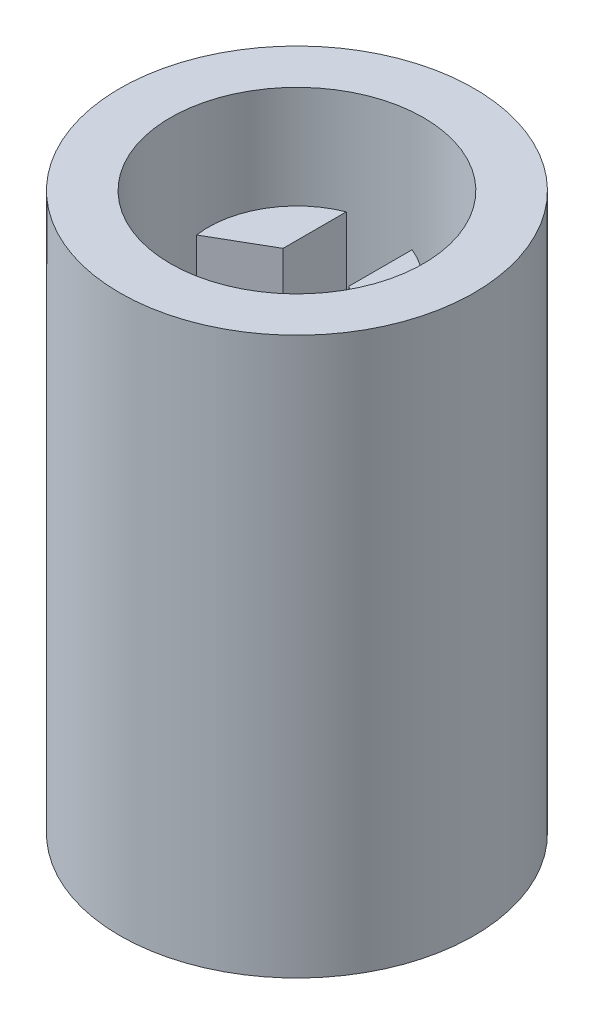
from build123d import *

# Parameters (mm, degrees)
SKETCH1_R           = 7
BOSS_EXTRUDE1_DEPTH = 22
CAVITY1_START       = 2
CAVITY1_OUTLINE_R   = 5
CAVITY1_DEPTH       = 20
CAVITY1_START_2     = 19
CAVITY1_2_DEPTH     = 3
CAVITY1_3_OUTLINE_R = 0.75
CAVITY1_3_DEPTH     = 2
SKETCH2_R           = 0.5
CUT_EXTRUDE1_DEPTH  = 23.315913604


# Read off the part's stored shape, not the designer's step: Cavity1
with BuildPart() as part:
    # Sketch1 → Boss-Extrude1 (new body)
    with BuildSketch(Plane(origin=(0, 0, 0), x_dir=(1, 0, 0), z_dir=(0, 1, 0))):
        with Locations(Location((0, 0, 0), (0, 0, 270))):
            Circle(SKETCH1_R)
    extrude(amount=BOSS_EXTRUDE1_DEPTH)

    # Cavity1 outline → Cavity1 (cut)
    with BuildSketch(Plane(origin=(0, 0, 0), x_dir=(1, 0, 0), z_dir=(0, 1, 0)).offset(CAVITY1_START)):
        Circle(CAVITY1_OUTLINE_R)
        with BuildLine():
            Line((0, -1.5), (2.165063509, -2.75))
            ThreePointArc((2.165063509, -2.75), (0, -3.5), (-2.165063509, -2.75))
            Line((-2.165063509, -2.75), (0, -1.5))
        make_face(mode=Mode.SUBTRACT)
        with BuildLine():
            Line((-1.299038106, 0.75), (-3.464101615, -0.5))
            ThreePointArc((-3.464101615, -0.5), (-3.031088913, 1.75), (-1.299038106, 3.25))
            Line((-1.299038106, 3.25), (-1.299038106, 0.75))
        make_face(mode=Mode.SUBTRACT)
        with BuildLine():
            Line((3.464101615, -0.5), (1.299038106, 0.75))
            Line((1.299038106, 0.75), (1.299038106, 3.25))
            ThreePointArc((1.299038106, 3.25), (3.031088913, 1.75), (3.464101615, -0.5))
        make_face(mode=Mode.SUBTRACT)
    extrude(amount=CAVITY1_DEPTH, mode=Mode.SUBTRACT)

    # Cavity1 2 outline → Cavity1 2 (cut)
    with BuildSketch(Plane(origin=(0, 0, 0), x_dir=(1, 0, 0), z_dir=(0, 1, 0)).offset(CAVITY1_START_2)):
        with BuildLine():
            Line((1.299038106, 3.25), (1.299038106, 0.75))
            Line((1.299038106, 0.75), (3.464101615, -0.5))
            ThreePointArc((3.464101615, -0.5), (3.031088913, 1.75), (1.299038106, 3.25))
        make_face()
        with BuildLine():
            ThreePointArc((-1.299038106, 3.25), (-3.031088913, 1.75), (-3.464101615, -0.5))
            Line((-3.464101615, -0.5), (-1.299038106, 0.75))
            Line((-1.299038106, 0.75), (-1.299038106, 3.25))
        make_face()
        with BuildLine():
            ThreePointArc((-2.165063509, -2.75), (0, -3.5), (2.165063509, -2.75))
            Line((2.165063509, -2.75), (0, -1.5))
            Line((0, -1.5), (-2.165063509, -2.75))
        make_face()
    extrude(amount=CAVITY1_2_DEPTH, mode=Mode.SUBTRACT)

    # Cavity1 3 outline → Cavity1 3 (cut)
    # profile 1 of 3: a face of its own
    with BuildSketch(Plane(origin=(0, 0, 0), x_dir=(1, 0, 0), z_dir=(0, 1, 0)).offset(CAVITY1_START)):
        with BuildLine():
            Line((1.299038106, 3.25), (1.299038106, 0.75))
            Line((1.299038106, 0.75), (3.464101615, -0.5))
            ThreePointArc((3.464101615, -0.5), (3.031088913, 1.75), (1.299038106, 3.25))
        make_face()
        with Locations((2.165063509, 1.25)):
            Circle(CAVITY1_3_OUTLINE_R, mode=Mode.SUBTRACT)
    # profile 2 of 3: a face of its own
    with BuildSketch(Plane(origin=(0, 0, 0), x_dir=(1, 0, 0), z_dir=(0, 1, 0)).offset(CAVITY1_START)):
        with BuildLine():
            ThreePointArc((-1.299038106, 3.25), (-3.031088913, 1.75), (-3.464101615, -0.5))
            Line((-3.464101615, -0.5), (-1.299038106, 0.75))
            Line((-1.299038106, 0.75), (-1.299038106, 3.25))
        make_face()
        with Locations((-2.165063509, 1.25)):
            Circle(CAVITY1_3_OUTLINE_R, mode=Mode.SUBTRACT)
    # profile 3 of 3: a face of its own
    with BuildSketch(Plane(origin=(0, 0, 0), x_dir=(1, 0, 0), z_dir=(0, 1, 0)).offset(CAVITY1_START)):
        with BuildLine():
            ThreePointArc((-2.165063509, -2.75), (0, -3.5), (2.165063509, -2.75))
            Line((2.165063509, -2.75), (0, -1.5))
            Line((0, -1.5), (-2.165063509, -2.75))
        make_face()
        with Locations((0, -2.5)):
            Circle(CAVITY1_3_OUTLINE_R, mode=Mode.SUBTRACT)
    extrude(amount=CAVITY1_3_DEPTH, mode=Mode.SUBTRACT)

    # Sketch2 → Cut-Extrude1 (cut, through all)
    with BuildSketch(Plane(origin=(0, 2, 0), x_dir=(1, 0, 0), z_dir=(0, 1, 0))):
        with Locations(Location((0, 0, 0), (0, 0, 270))):
            Circle(SKETCH2_R)
    extrude(amount=-CUT_EXTRUDE1_DEPTH, mode=Mode.SUBTRACT)


solid = part.part
